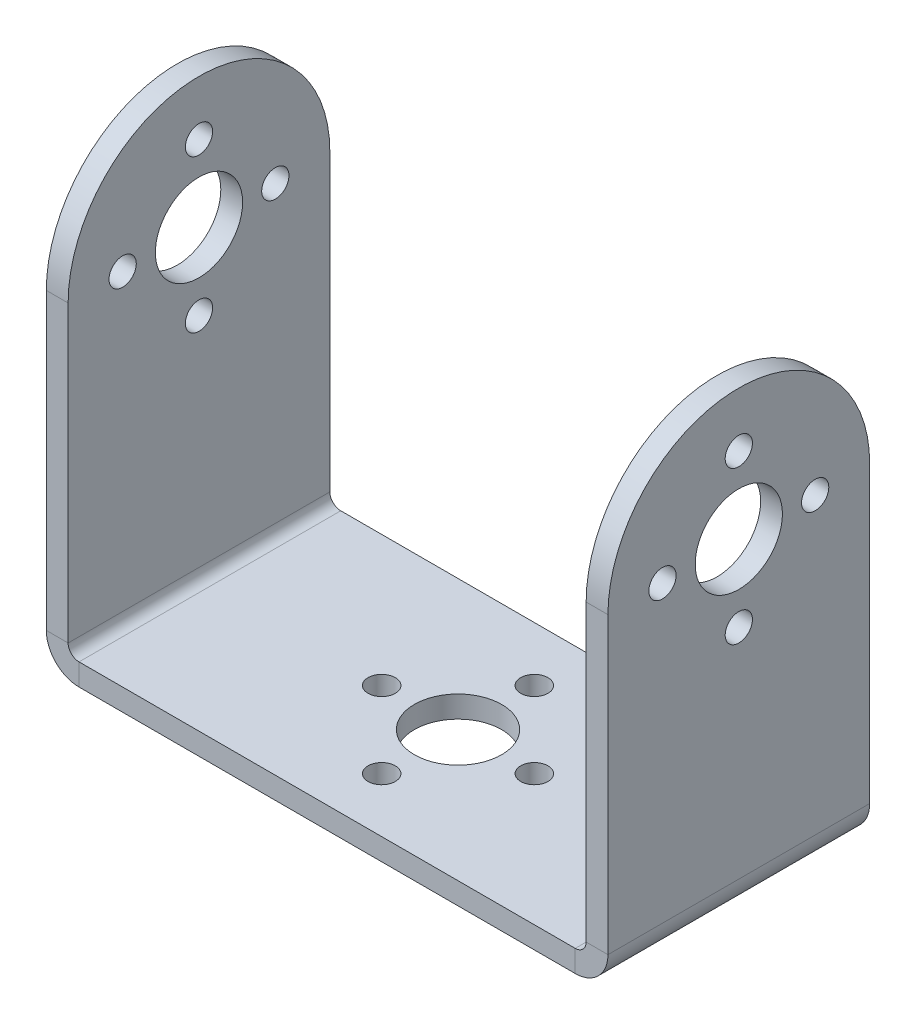
from build123d import *

# Parameters (mm, degrees)
T_LE_DE_BASE_PLI_E1_DEPTH       = 12
ENL_V_START                     = -51.5
ENL_V_MAT_EXTRU_1_DEPTH         = 51.5
DIAM_TRE_DU_PER_AGE_8_0_8_1_D   = 8
DIAM_TRE_DU_PER_AGE_2_5_2_5_1_D = 2.5
DIAM_TRE_DU_PER_AGE_8_0_8_2_D   = 8
DIAM_TRE_DU_PER_AGE_2_5_2_5_2_D = 2.5


# Read off the part's stored shape, not the designer's step: Enlèv. mat.-Extru.1
# Sheet-metal steps are written as plain solids
with BuildPart() as part:
    # Esquisse1 → Tôle de base pliée1 (new, symmetric)
    with BuildSketch(Plane.XY):
        with BuildLine():
            Line((-25.75, 42), (-25.75, 3))
            ThreePointArc((-25.75, 3), (-24.871320344, 0.878679656), (-22.75, 0))
            Line((-22.75, 0), (22.75, 0))
            ThreePointArc((22.75, 0), (24.871320344, 0.878679656), (25.75, 3))
            Line((25.75, 3), (25.75, 42))
            Line((25.75, 42), (23.75, 42))
            Line((23.75, 42), (23.75, 3))
            ThreePointArc((23.75, 3), (23.457106781, 2.292893219), (22.75, 2))
            Line((22.75, 2), (-22.75, 2))
            ThreePointArc((-22.75, 2), (-23.457106781, 2.292893219), (-23.75, 3))
            Line((-23.75, 3), (-23.75, 42))
            Line((-23.75, 42), (-25.75, 42))
        make_face()
    extrude(amount=T_LE_DE_BASE_PLI_E1_DEPTH, both=True)

    # Enlèv. mat.-Extru.1 outline → Enlèv. mat.-Extru.1 (cut)
    with BuildSketch(Plane(origin=(25.75, 0, 0), x_dir=(0, 0, -1), z_dir=(1, 0, 0)).offset(ENL_V_START)):
        with BuildLine():
            ThreePointArc((-12, 30), (-8.485281374, 38.485281374), (0, 42))
            Line((0, 42), (-12, 42))
            Line((-12, 42), (-12, 30))
        make_face()
        with BuildLine():
            ThreePointArc((0, 42), (8.485281374, 38.485281374), (12, 30))
            Line((12, 30), (12, 42))
            Line((12, 42), (0, 42))
        make_face()
    extrude(amount=ENL_V_MAT_EXTRU_1_DEPTH, mode=Mode.SUBTRACT)

    # Diamètre du perçage Ø8.0 (8)1 (through all)
    with Locations(Plane(origin=(25.75, 0, 0), x_dir=(0, 0, -1), z_dir=(1, 0, 0))):
        with Locations((0, 30)):
            Hole(DIAM_TRE_DU_PER_AGE_8_0_8_1_D / 2)

    # Diamètre du perçage Ø2.5 (2.5)1 (through all)
    with Locations(Plane(origin=(25.75, 0, 0), x_dir=(0, 0, -1), z_dir=(1, 0, 0))):
        with Locations((-7, 30), (0, 37), (7, 30), (0, 23)):
            Hole(DIAM_TRE_DU_PER_AGE_2_5_2_5_1_D / 2)

    # Diamètre du perçage Ø8.0 (8)2 (through all)
    with Locations(Plane(origin=(0, 2, 0), x_dir=(1, 0, 0), z_dir=(0, 1, 0))):
        with Locations((0, 0)):
            Hole(DIAM_TRE_DU_PER_AGE_8_0_8_2_D / 2)

    # Diamètre du perçage Ø2.5 (2.5)2 (through all)
    with Locations(Plane(origin=(0, 2, 0), x_dir=(1, 0, 0), z_dir=(0, 1, 0))):
        with Locations((-7, 0), (0, 7), (7, 0), (0, -7)):
            Hole(DIAM_TRE_DU_PER_AGE_2_5_2_5_2_D / 2)


solid = part.part
